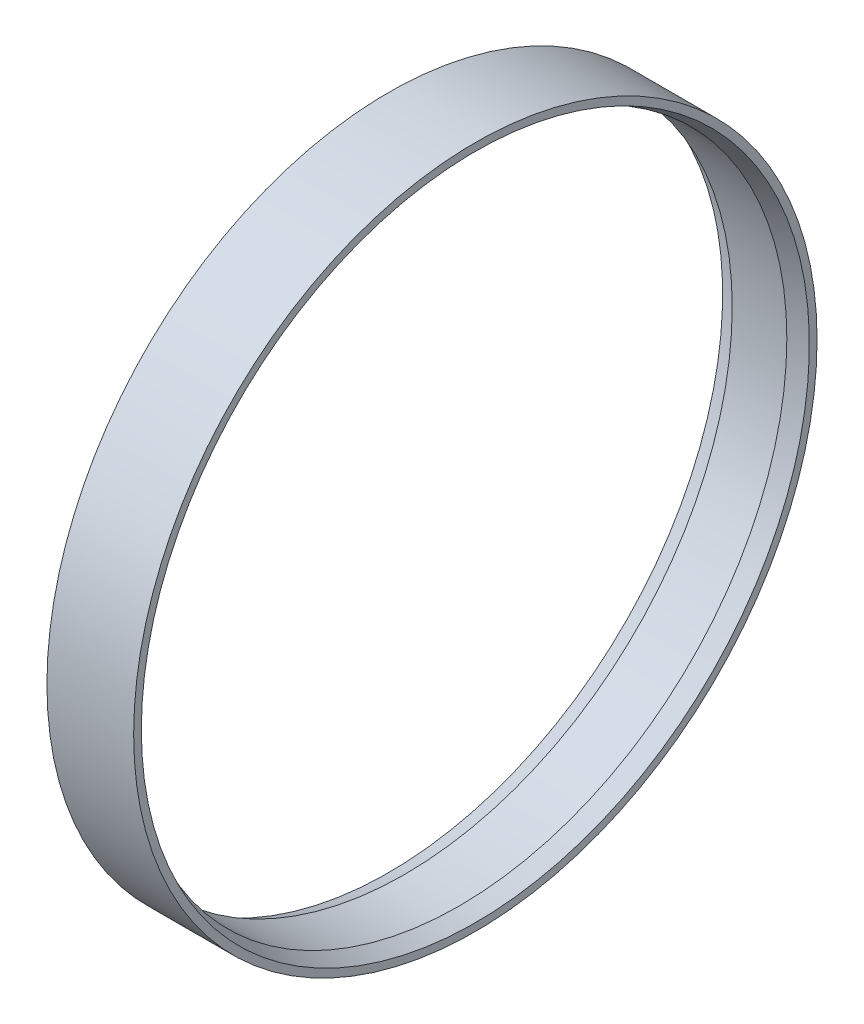
from build123d import *


with BuildPart() as part:
    # Szkic2 → Obrót1 (revolve)
    with BuildSketch(Plane.XY):
        Polygon((-6.742894881, 0.099810146), (-4.252369572, -0.900189854), (4.249525366, -0.900189854), (6.757104779, 0.102841911), (6.757104779, 1.299810146), (-6.742894881, 1.299810146), align=None)
    revolve(axis=Axis((-9.718374517, -51.900189854, 0), (1, 0, 0)))


solid = part.part
